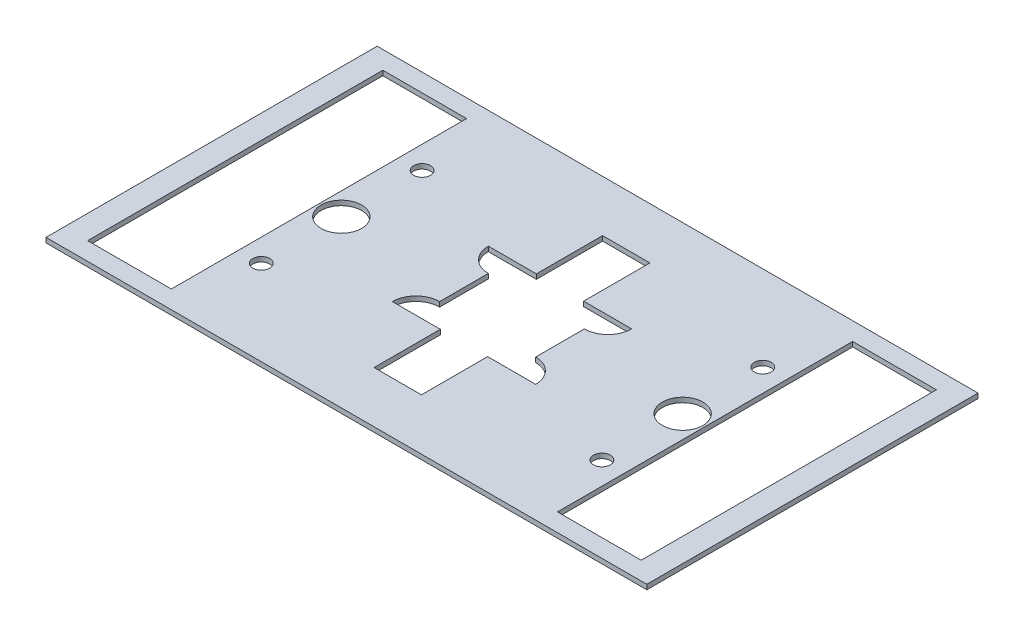
from build123d import *

# Parameters (mm, degrees)
SKETCH1_W           = 63.5
SKETCH1_H           = 35
SKETCH1_R           = 0.889
SKETCH1_W_2         = 8.85
SKETCH1_H_2         = 31.2
SKETCH1_R_2         = 2.144603346
BOSS_EXTRUDE1_DEPTH = 0.508


with BuildPart() as part:
    # Sketch1 → Boss-Extrude1 (new body)
    with BuildSketch(Plane(origin=(0, 0, 0), x_dir=(1, 0, 0), z_dir=(0, 1, 0))):
        Rectangle(SKETCH1_W, SKETCH1_H)
        with BuildLine():
            Line((-2.5, 5.075), (-2.5, 12.075))
            Line((-2.5, 12.075), (2.5, 12.075))
            Line((2.5, 12.075), (2.5, 5.075))
            Line((2.5, 5.075), (7.575, 5.075))
            ThreePointArc((7.575, 5.075), (6.842766953, 3.307233047), (5.075, 2.575))
            Line((5.075, 2.575), (5.075, -2.575))
            ThreePointArc((5.075, -2.575), (6.842766953, -3.307233047), (7.575, -5.075))
            Line((7.575, -5.075), (2.5, -5.075))
            Line((2.5, -5.075), (2.5, -12.075))
            Line((2.5, -12.075), (-2.5, -12.075))
            Line((-2.5, -12.075), (-2.5, -5.075))
            Line((-2.5, -5.075), (-7.575, -5.075))
            ThreePointArc((-7.575, -5.075), (-6.842766953, -3.307233047), (-5.075, -2.575))
            Line((-5.075, -2.575), (-5.075, 2.575))
            ThreePointArc((-5.075, 2.575), (-6.842766953, 3.307233047), (-7.575, 5.075))
            Line((-7.575, 5.075), (-2.5, 5.075))
        make_face(mode=Mode.SUBTRACT)
        with Locations((-18, -8.5)):
            Circle(SKETCH1_R, mode=Mode.SUBTRACT)
        with Locations((18, -8.5)):
            Circle(SKETCH1_R, mode=Mode.SUBTRACT)
        with Locations((-24.825, 0)):
            Rectangle(SKETCH1_W_2, SKETCH1_H_2, mode=Mode.SUBTRACT)
        with Locations((-18.034, 0)):
            Circle(SKETCH1_R_2, mode=Mode.SUBTRACT)
        with Locations((-18, 8.5)):
            Circle(SKETCH1_R, mode=Mode.SUBTRACT)
        with Locations((18, 8.5)):
            Circle(SKETCH1_R, mode=Mode.SUBTRACT)
        with Locations((18.034, 0)):
            Circle(SKETCH1_R_2, mode=Mode.SUBTRACT)
        with Locations((24.825, 0)):
            Rectangle(SKETCH1_W_2, SKETCH1_H_2, mode=Mode.SUBTRACT)
    extrude(amount=BOSS_EXTRUDE1_DEPTH)


solid = part.part
